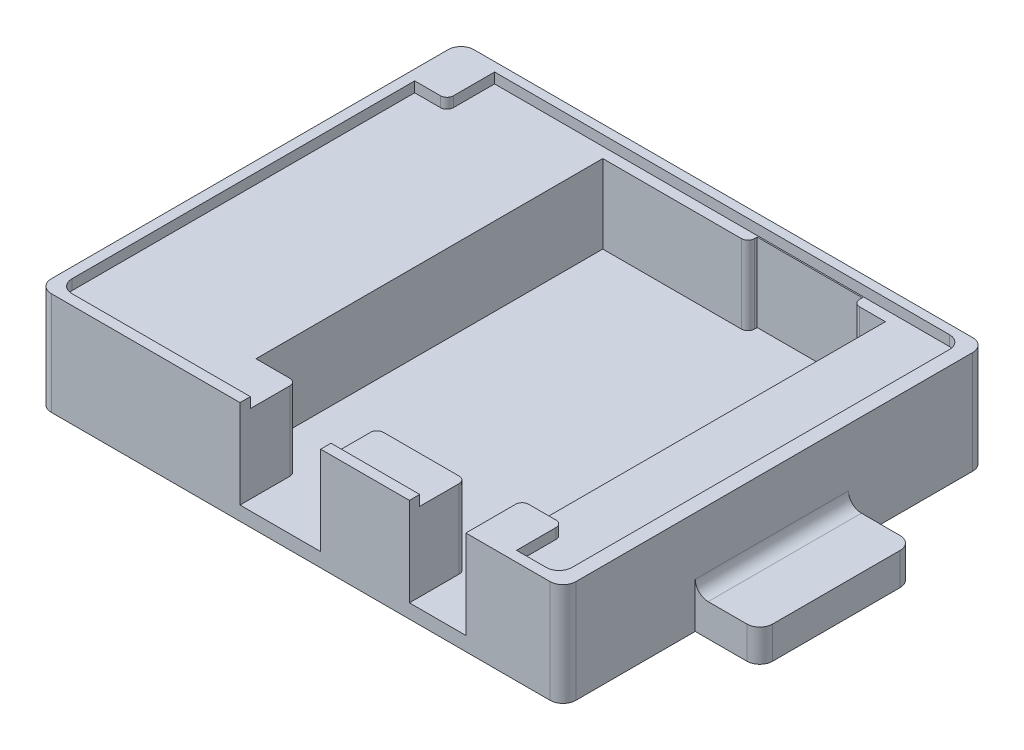
from build123d import *

# Parameters (mm, degrees)
SKETCH1_W           = 103.251
SKETCH1_H           = 83.185
BOSS_EXTRUDE1_DEPTH = 20.2438
CUT_EXTRUDE1_DEPTH  = 17.4625
SKETCH3_W           = 15.875
SKETCH3_H           = 17.4625
SKETCH3_W_2         = 11.1125
CUT_EXTRUDE2_DEPTH  = 14.9225
CUT_EXTRUDE3_DEPTH  = 2.032
SKETCH5_W           = 30.1625
SKETCH5_H           = 6.35
BOSS_EXTRUDE2_DEPTH = 12.7
SKETCH6_W           = 30.1625
SKETCH6_H           = 6.35
BOSS_EXTRUDE3_DEPTH = 12.7
FILLET1_R           = 2.54
FILLET2_R           = 1.27
FILLET3_R           = 2.54
FILLET4_R           = 2.54


with BuildPart() as part:
    # Sketch1 → Boss-Extrude1 (new body)
    with BuildSketch(Plane(origin=(0, 0, 0), x_dir=(1, 0, 0), z_dir=(0, 1, 0))):
        with Locations((51.6255, 41.5925)):
            Rectangle(SKETCH1_W, SKETCH1_H)
    extrude(amount=BOSS_EXTRUDE1_DEPTH)

    # Sketch2 → Cut-Extrude1 (cut)
    with BuildSketch(Plane(origin=(0, 20.2438, 0), x_dir=(1, 0, 0), z_dir=(0, 1, 0))):
        Polygon((31.75, 79.3369), (60.325, 79.3369), (60.325, 81.153), (81.026, 81.153), (81.026, 79.3369), (87.376, 79.3369), (87.376, 11.0744), (31.75, 11.0744), align=None)
    extrude(amount=-CUT_EXTRUDE1_DEPTH, mode=Mode.SUBTRACT)

    # Sketch3 → Cut-Extrude2 (cut)
    with BuildSketch(Plane.XY):
        with Locations((47.625, 11.51255)):
            Rectangle(SKETCH3_W, SKETCH3_H)
        with Locations((78.58125, 11.51255)):
            Rectangle(SKETCH3_W_2, SKETCH3_H)
    extrude(amount=-CUT_EXTRUDE2_DEPTH, mode=Mode.SUBTRACT)

    # Sketch4 → Cut-Extrude3 (cut)
    with BuildSketch(Plane(origin=(0, 20.2438, 0), x_dir=(1, 0, 0), z_dir=(0, 1, 0))):
        Polygon((8.382, 81.407), (100.457, 81.407), (100.457, 2.032), (92.075, 2.032), (92.075, 11.0744), (84.1375, 11.0744), (84.1375, 2.032), (2.032, 2.032), (2.032, 72.0344), (8.382, 72.0344), align=None)
    extrude(amount=-CUT_EXTRUDE3_DEPTH, mode=Mode.SUBTRACT)

    # Sketch5 → Boss-Extrude2 (add)
    with BuildSketch(Plane.ZY):
        with Locations((-41.11625, 3.175)):
            Rectangle(SKETCH5_W, SKETCH5_H)
    boss_extrude2 = extrude(amount=BOSS_EXTRUDE2_DEPTH)

    # Mirror1: Boss-Extrude2 across plane
    add(boss_extrude2.mirror(Plane.ZY.offset(-51.6255)))

    # Sketch6 → Boss-Extrude3 (add)
    with BuildSketch(Plane(origin=(0, 0, -83.185), x_dir=(-1, 0, 0), z_dir=(0, 0, -1))):
        with Locations((-51.65725, 3.175)):
            Rectangle(SKETCH6_W, SKETCH6_H)
    extrude(amount=BOSS_EXTRUDE3_DEPTH)

    # Fillet1
    fillet1_edges = [part.edges().sort_by_distance(p)[0] for p in [
        (103.251, 10.1219, 0),
        (115.951, 3.175, -26.035),
        (115.951, 3.175, -56.1975),
        (103.251, 10.1219, -83.185),
        (66.7385, 3.175, -95.885),
        (36.576, 3.175, -95.885),
        (0, 10.1219, -83.185),
        (-12.7, 3.175, -56.1975),
        (-12.7, 3.175, -26.035),
        (0, 10.1219, 0),
    ]]
    fillet(fillet1_edges, radius=FILLET1_R)

    # Fillet2
    fillet2_edges = [part.edges().sort_by_distance(p)[0] for p in [
        (39.6875, 10.49655, -11.0744),
        (55.5625, 10.49655, -11.0744),
        (73.025, 10.49655, -11.0744),
        (92.075, 19.2278, -11.0744),
        (84.1375, 11.51255, -11.0744),
        (81.026, 10.49655, -79.3369),
        (60.325, 10.49655, -79.3369),
        (8.382, 19.2278, -72.0344),
    ]]
    fillet(fillet2_edges, radius=FILLET2_R)

    # Fillet3
    fillet3_edges = [part.edges().sort_by_distance(p)[0] for p in [
        (100.457, 19.2278, -81.407),
        (100.457, 19.2278, -2.032),
        (2.032, 19.2278, -2.032),
    ]]
    fillet(fillet3_edges, radius=FILLET3_R)

    # Fillet4
    fillet4_edges = [part.edges().sort_by_distance(p)[0] for p in [
        (0, 6.35, -41.11625),
        (51.65725, 6.35, -83.185),
        (103.251, 6.35, -41.11625),
    ]]
    fillet(fillet4_edges, radius=FILLET4_R)


solid = part.part
